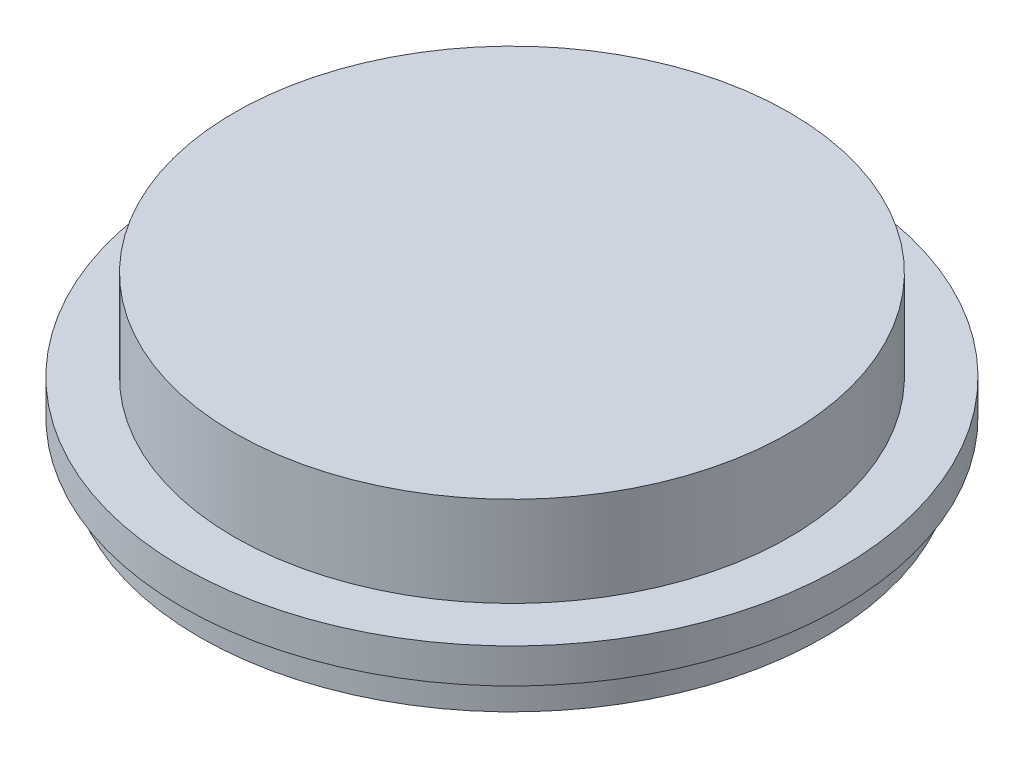
from build123d import *


with BuildPart() as part:
    # Sketch1 → Revolve1 (revolve)
    with BuildSketch(Plane.XY):
        Polygon((60.325, -6.35), (60.325, 0), (50.8, 0), (50.8, 16.51), (0, 16.51), (0, 10.16), (44.45, 10.16), (44.45, -6.35), (50.8, -6.35), (50.8, -12.7), (57.15, -12.7), (57.15, -6.35), align=None)
    revolve(axis=Axis((0, 3.81, 0), (0, -1, 0)))


solid = part.part
